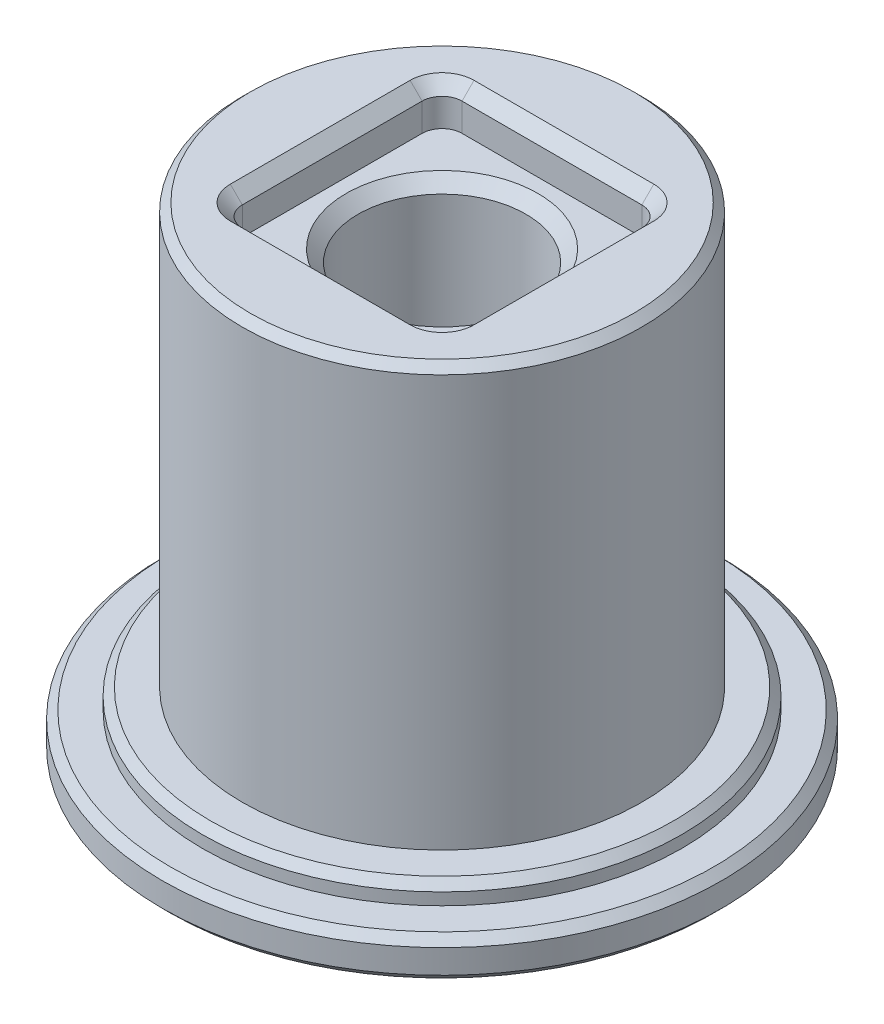
from build123d import *

# Parameters (mm, degrees)
SKETCH_1_R      = 7
SKETCH_1_R_2    = 6
EXTRUDE_1_DEPTH = 1
SKETCH_1_4_R    = 6
SKETCH_1_4_R_2  = 5
EXTRUDE_2_DEPTH = 1.5
SKETCH_1_5_R    = 5
SKETCH_1_5_R_2  = 4.25
EXTRUDE_3_DEPTH = 12
EXTRUDE_START   = 5
SKETCH_1_6_R    = 4.25
SKETCH_1_6_W    = 5.5
SKETCH_1_6_H    = 5.5
EXTRUDE_4_DEPTH = 7
SKETCH_1_7_W    = 5.5
SKETCH_1_7_H    = 5.5
SKETCH_1_7_R    = 2.1
EXTRUDE_5_DEPTH = 6
FILLET_1_R      = 0.5
CHAMFER_1_SIZE  = 0.2
CHAMFER_2_SIZE  = 0.3
CHAMFER_3_SIZE  = 0.3


with BuildPart() as part:
    # 스케치1 → 보스-돌출1 (new body)
    with BuildSketch(Plane(origin=(0, 0, 0), x_dir=(1, 0, 0), z_dir=(0, 1, 0))):
        Circle(SKETCH_1_R)
        Circle(SKETCH_1_R_2, mode=Mode.SUBTRACT)
    extrude(amount=EXTRUDE_1_DEPTH)

    # 스케치1<4> → 보스-돌출2 (add)
    with BuildSketch(Plane(origin=(0, 0, 0), x_dir=(1, 0, 0), z_dir=(0, 1, 0))):
        Circle(SKETCH_1_4_R)
        Circle(SKETCH_1_4_R_2, mode=Mode.SUBTRACT)
    extrude(amount=EXTRUDE_2_DEPTH)

    # 스케치1<5> → 보스-돌출3 (add)
    with BuildSketch(Plane(origin=(0, 0, 0), x_dir=(1, 0, 0), z_dir=(0, 1, 0))):
        Circle(SKETCH_1_5_R)
        Circle(SKETCH_1_5_R_2, mode=Mode.SUBTRACT)
    extrude(amount=EXTRUDE_3_DEPTH)

    # 스케치1<6> → 보스-돌출4 (add)
    with BuildSketch(Plane(origin=(0, 0, 0), x_dir=(1, 0, 0), z_dir=(0, 1, 0)).offset(EXTRUDE_START)):
        Circle(SKETCH_1_6_R)
        Rectangle(SKETCH_1_6_W, SKETCH_1_6_H, mode=Mode.SUBTRACT)
    extrude(amount=EXTRUDE_4_DEPTH)

    # 스케치1<7> → 보스-돌출5 (add)
    with BuildSketch(Plane(origin=(0, 0, 0), x_dir=(1, 0, 0), z_dir=(0, 1, 0)).offset(EXTRUDE_START)):
        Rectangle(SKETCH_1_7_W, SKETCH_1_7_H)
        Circle(SKETCH_1_7_R, mode=Mode.SUBTRACT)
    extrude(amount=EXTRUDE_5_DEPTH)

    # 필렛1
    fillet_1_edges = [part.edges().sort_by_distance(p)[0] for p in [
        (2.75, 11.5, 2.75),
        (-2.75, 11.5, 2.75),
        (2.75, 11.5, -2.75),
        (-2.75, 11.5, -2.75),
    ]]
    fillet(fillet_1_edges, radius=FILLET_1_R)

    # 모따기1
    chamfer_1_edges = [part.edges().sort_by_distance(p)[0] for p in [
        (-5, 12, 0),
        (-7, 1, 0),
        (-7, 0, 0),
        (-6, 1.5, 0),
    ]]
    chamfer(chamfer_1_edges, length=CHAMFER_1_SIZE)

    # 모따기2
    chamfer_2_edges = [part.edges().sort_by_distance(p)[0] for p in [
        (-4.25, 0, 0),
    ]]
    chamfer(chamfer_2_edges, length=CHAMFER_2_SIZE)

    # 모따기3
    chamfer_3_edges = [part.edges().sort_by_distance(p)[0] for p in [
        (-2.1, 11, 0),
        (0, 12, 2.75),
        (2.75, 12, 0),
        (-2.75, 12, 0),
        (0, 12, -2.75),
        (-2.603553391, 12, 2.603553391),
        (2.603553391, 12, 2.603553391),
        (-2.603553391, 12, -2.603553391),
        (2.603553391, 12, -2.603553391),
    ]]
    chamfer(chamfer_3_edges, length=CHAMFER_3_SIZE)


solid = part.part
